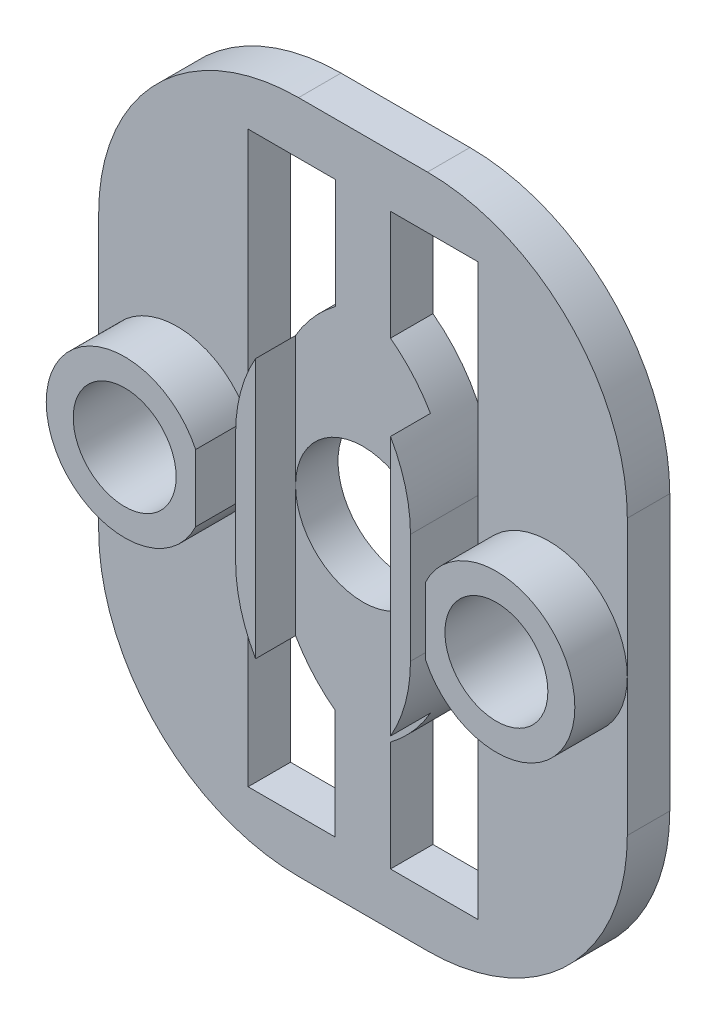
from build123d import *

# Parameters (mm, degrees)
SKETCH1_R           = 2.6162
BOSS_EXTRUDE1_DEPTH = 2.159
SKETCH2_R           = 3.429
CUT_EXTRUDE1_DEPTH  = 32.658081505
FILLET1_R           = 10.16
SKETCH3_W           = 1.016
SKETCH3_H           = 17.78
BOSS_EXTRUDE2_DEPTH = 2.032
SKETCH4_R           = 3.9878
SKETCH4_R_2         = 2.6162
BOSS_EXTRUDE3_DEPTH = 2.667
FILLET2_R           = 7.62
SKETCH6_W           = 0.381
SKETCH6_H           = 28.956
CUT_EXTRUDE2_DEPTH  = 32.950948649


with BuildPart() as part:
    # Sketch1 → Boss-Extrude1 (new body)
    with BuildSketch(Plane.XY):
        Polygon((-1.016, -8.255), (-8.9916, -8.255), (-8.9916, 26.035), (-1.016, 26.035), (9.906, 26.035), (17.8816, 26.035), (17.8816, -8.255), (9.906, -8.255), align=None)
        with Locations((13.8938, 8.89)):
            Circle(SKETCH1_R, mode=Mode.SUBTRACT)
        with Locations((-5.0038, 8.89)):
            Circle(SKETCH1_R, mode=Mode.SUBTRACT)
        Polygon((0, 0), (0, 17.78), (3.048, 17.78), (3.048, 23.368), (-1.016, 23.368), (-1.016, 18.288), (-1.016, 0.508), (-1.016, -5.588), (3.016124998, -5.588), (3.016124998, 0), align=None, mode=Mode.SUBTRACT)
        Polygon((8.89, 0), (8.89, 17.78), (5.842, 17.78), (5.842, 23.368), (9.906, 23.368), (9.906, 17.78), (9.906, 0), (9.906, -5.588), (5.842, -5.588), (5.842, 0), align=None, mode=Mode.SUBTRACT)
    extrude(amount=BOSS_EXTRUDE1_DEPTH)

    # Sketch2 → Cut-Extrude1 (cut, through all)
    with BuildSketch(Plane.XY.offset(2.159)):
        with Locations((4.445, 8.89)):
            Circle(SKETCH2_R)
    extrude(amount=-CUT_EXTRUDE1_DEPTH, mode=Mode.SUBTRACT)

    # Fillet1
    fillet1_edges = [part.edges().sort_by_distance(p)[0] for p in [
        (17.8816, -8.255, 1.0795),
        (-8.9916, -8.255, 1.0795),
        (-8.9916, 26.035, 1.0795),
        (17.8816, 26.035, 1.0795),
    ]]
    fillet(fillet1_edges, radius=FILLET1_R)

    # Sketch3 → Boss-Extrude2 (add)
    with BuildSketch(Plane.XY.offset(2.159)):
        with Locations((0.508, 8.89)):
            Rectangle(SKETCH3_W, SKETCH3_H)
        with Locations((8.382, 8.89)):
            Rectangle(SKETCH3_W, SKETCH3_H)
    extrude(amount=BOSS_EXTRUDE2_DEPTH)

    # Sketch4 → Boss-Extrude3 (add)
    # profile 1 of 2: a face of its own
    with BuildSketch(Plane.XY.offset(2.159)):
        with Locations((-5.0038, 8.89)):
            Circle(SKETCH4_R)
        with Locations((-5.0038, 8.89)):
            Circle(SKETCH4_R_2, mode=Mode.SUBTRACT)
    # profile 2 of 2: a face of its own
    with BuildSketch(Plane.XY.offset(2.159)):
        with Locations((13.8938, 8.89)):
            Circle(SKETCH4_R)
        with Locations((13.8938, 8.89)):
            Circle(SKETCH4_R_2, mode=Mode.SUBTRACT)
    extrude(amount=BOSS_EXTRUDE3_DEPTH)

    # Fillet2
    # the kernel refuses this fillet: 7.62 mm, written as the material it takes off along each edge
    with BuildSketch(Plane(origin=(8.89, 0, -15.24), x_dir=(0, 1, 0), z_dir=(0, 0, 1))) as fillet2_piece_1:
        with BuildLine():
            CenterArc((6.096, 7.62), FILLET2_R, 216.869897646, 53.130102354)
            Line((0, 3.048), (-0.12192, 2.95656))
            ThreePointArc((-0.12192, 2.95656), (-0.1524, 1.524), (-0.1524, 0))
            Line((-0.1524, 0), (0, -0.1524))
            Line((0, -0.1524), (6.096, -0.1524))
            Line((6.096, -0.1524), (6.096, 0))
        make_face()
    extrude(amount=34.671, mode=Mode.SUBTRACT)
    with BuildSketch(Plane(origin=(0, 0, -15.17990756), x_dir=(0, 1, 0), z_dir=(0, 0, 1))) as fillet2_piece_2:
        with BuildLine():
            CenterArc((6.071963024, -7.62), FILLET2_R, 90, 52.82992082)
            Line((0, -3.016124998), (-0.12143926, -2.924047498))
            ThreePointArc((-0.12143926, -2.924047498), (-0.1524, -1.508062499), (-0.1524, 0))
            Line((-0.1524, 0), (0, 0.1524))
            Line((0, 0.1524), (6.071963024, 0.1524))
            Line((6.071963024, 0.1524), (6.071963024, 0))
        make_face()
    extrude(amount=34.550815121, mode=Mode.SUBTRACT)
    with BuildSketch(Plane(origin=(0, 17.78, 19.431), x_dir=(1, 0, 0), z_dir=(0, 0, -1)), Plane(origin=(8.89, 17.78, -15.24), x_dir=(-1, 0, 0), z_dir=(0, 0, 1))) as fillet2_piece_3:
        with BuildLine():
            CenterArc((7.62, 6.096), FILLET2_R, 180, 53.130102354)
            Line((0, 6.096), (-0.1524, 6.096))
            Line((-0.1524, 6.096), (-0.1524, 0))
            Line((-0.1524, 0), (0, -0.1524))
            ThreePointArc((0, -0.1524), (1.524, -0.1524), (2.95656, -0.12192))
            Line((2.95656, -0.12192), (3.048, 0))
        make_face()
    extrude(amount=34.671, mode=Mode.SUBTRACT)

    # Sketch6 → Cut-Extrude2 (cut, through all)
    with BuildSketch(Plane(origin=(0, 0, 0), x_dir=(-1, 0, 0), z_dir=(0, 0, -1))):
        with Locations((1.2065, 8.89)):
            Rectangle(SKETCH6_W, SKETCH6_H)
        with Locations((-10.0965, 8.89)):
            Rectangle(SKETCH6_W, SKETCH6_H)
    extrude(amount=-CUT_EXTRUDE2_DEPTH, mode=Mode.SUBTRACT)


solid = part.part
